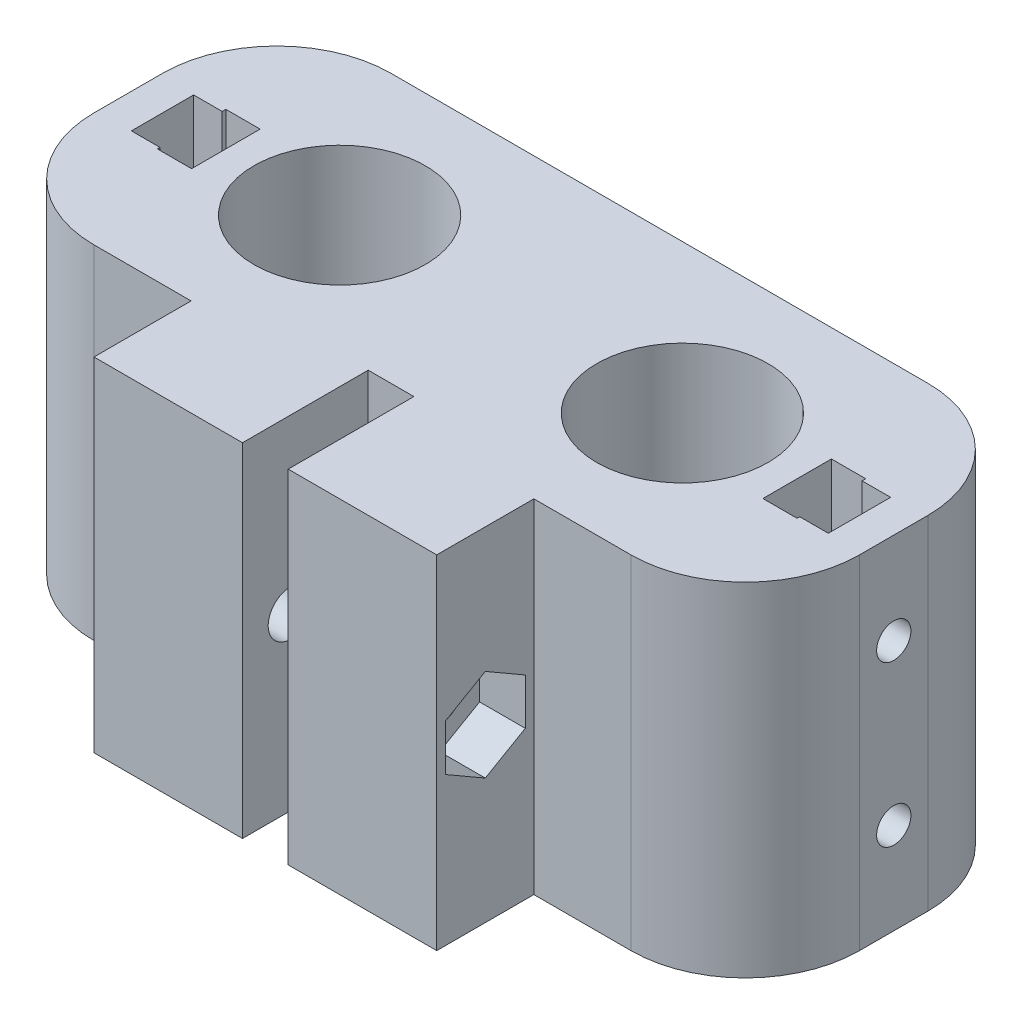
from build123d import *

# Parameters (mm, degrees)
BOSS_EXTRUDE1_OUTLINE_R = 7.5
BOSS_EXTRUDE1_DEPTH     = 30
SKETCH1_3_R             = 7.5
SKETCH1_3_R_2           = 5
BOSS_EXTRUDE2_DEPTH     = 5
FILLET1_R               = 10
CUT_EXTRUDE6_DEPTH      = 4
SKETCH5_3_R             = 2
CUT_EXTRUDE7_DEPTH      = 35
SKETCH10_R              = 1.5
CUT_EXTRUDE11_DEPTH     = 4
CUT_EXTRUDE12_START     = -2.5
SKETCH10_5_R            = 1.5
CUT_EXTRUDE12_DEPTH     = 2.5
CUT_EXTRUDE13_DEPTH     = 34


# Read off the part's stored shape, not the designer's step: Boss-Extrude1
with BuildPart() as part:
    # Boss-Extrude1 outline → Boss-Extrude1 (new body)
    with BuildSketch(Plane(origin=(0, 0, 0), x_dir=(1, 0, 0), z_dir=(0, 1, 0))):
        Polygon((-33.5, 13), (-33.5, -13), (-15, -13), (-15, -21.5), (-2, -21.5), (-2, -10.5), (2, -10.5), (2, -21.5), (15, -21.5), (15, -13), (33.5, -13), (33.5, 13), align=None)
        with Locations((-15, 0)):
            Circle(BOSS_EXTRUDE1_OUTLINE_R, mode=Mode.SUBTRACT)
        with Locations((15, 0)):
            Circle(BOSS_EXTRUDE1_OUTLINE_R, mode=Mode.SUBTRACT)
    extrude(amount=BOSS_EXTRUDE1_DEPTH)

    # Sketch1<3> → Boss-Extrude2 (add)
    # profile 1 of 2: a face of its own
    with BuildSketch(Plane(origin=(0, 0, 0), x_dir=(1, 0, 0), z_dir=(0, 1, 0))):
        with Locations(Location((-15, 0, 0), (0, 0, 270))):
            Circle(SKETCH1_3_R)
        with Locations(Location((-15, 0, 0), (0, 0, 270))):
            Circle(SKETCH1_3_R_2, mode=Mode.SUBTRACT)
    # profile 2 of 2: a face of its own
    with BuildSketch(Plane(origin=(0, 0, 0), x_dir=(1, 0, 0), z_dir=(0, 1, 0))):
        with Locations(Location((15, 0, 0), (0, 0, 270))):
            Circle(SKETCH1_3_R)
        with Locations(Location((15, 0, 0), (0, 0, 270))):
            Circle(SKETCH1_3_R_2, mode=Mode.SUBTRACT)
    extrude(amount=BOSS_EXTRUDE2_DEPTH)

    # Fillet1
    fillet1_edges = [part.edges().sort_by_distance(p)[0] for p in [
        (-33.5, 15, -13),
        (33.5, 15, -13),
        (33.5, 15, 13),
        (-33.5, 15, 13),
    ]]
    fillet(fillet1_edges, radius=FILLET1_R)

    # Sketch5 → Cut-Extrude6 (cut)
    with BuildSketch(Plane(origin=(15, 0, 0), x_dir=(0, 0, -1), z_dir=(1, 0, 0))):
        with BuildLine():
            Line((-20.75, 17.020725942), (-20.75, 15))
            Line((-20.75, 15), (-19.25, 15))
            ThreePointArc((-19.25, 15), (-17.25, 17), (-15.25, 15))
            Line((-15.25, 15), (-13.75, 15))
            Line((-13.75, 15), (-13.75, 17.020725942))
            Line((-13.75, 17.020725942), (-17.25, 19.041451884))
            Line((-17.25, 19.041451884), (-20.75, 17.020725942))
        make_face()
        with BuildLine():
            Line((-19.25, 15), (-20.75, 15))
            Line((-20.75, 15), (-20.75, 12.979274058))
            Line((-20.75, 12.979274058), (-17.25, 10.958548116))
            Line((-17.25, 10.958548116), (-13.75, 12.979274058))
            Line((-13.75, 12.979274058), (-13.75, 15))
            Line((-13.75, 15), (-15.25, 15))
            ThreePointArc((-15.25, 15), (-17.25, 13), (-19.25, 15))
        make_face()
    extrude(amount=-CUT_EXTRUDE6_DEPTH, mode=Mode.SUBTRACT)

    # Sketch5<3> → Cut-Extrude7 (cut)
    with BuildSketch(Plane(origin=(15, 0, 0), x_dir=(0, 0, -1), z_dir=(1, 0, 0))):
        with Locations((-17.25, 15)):
            Circle(SKETCH5_3_R)
    extrude(amount=-CUT_EXTRUDE7_DEPTH, mode=Mode.SUBTRACT)

    # Sketch10 → Cut-Extrude11 (cut)
    with BuildSketch(Plane(origin=(30.5, 0, 0), x_dir=(0, 0, -1), z_dir=(1, 0, 0))):
        with Locations((0, 22)):
            Circle(SKETCH10_R)
        with Locations((0, 8)):
            Circle(SKETCH10_R)
    cut_extrude11 = extrude(amount=CUT_EXTRUDE11_DEPTH, mode=Mode.SUBTRACT)

    # Sketch10<5> → Cut-Extrude12 (cut)
    # profile 1 of 5: a face of its own
    with BuildSketch(Plane(origin=(30.5, 0, 0), x_dir=(0, 0, -1), z_dir=(1, 0, 0)).offset(CUT_EXTRUDE12_START)):
        Polygon((-2.725, 30), (2.725, 30), (2.725, 23.573279484), (0, 25.146558967), (-2.725, 23.573279484), align=None)
    # profile 2 of 5: a face of its own
    with BuildSketch(Plane(origin=(30.5, 0, 0), x_dir=(0, 0, -1), z_dir=(1, 0, 0)).offset(CUT_EXTRUDE12_START)):
        Polygon((2.725, 20.426720516), (2.725, 23.573279484), (0, 25.146558967), (-2.725, 23.573279484), (-2.725, 20.426720516), (0, 18.853441033), align=None)
        with Locations((0, 22)):
            Circle(SKETCH10_5_R, mode=Mode.SUBTRACT)
    # profile 3 of 5: a face of its own
    with BuildSketch(Plane(origin=(30.5, 0, 0), x_dir=(0, 0, -1), z_dir=(1, 0, 0)).offset(CUT_EXTRUDE12_START)):
        with Locations((0, 22)):
            Circle(SKETCH10_5_R)
    # profile 4 of 5: a face of its own
    with BuildSketch(Plane(origin=(30.5, 0, 0), x_dir=(0, 0, -1), z_dir=(1, 0, 0)).offset(CUT_EXTRUDE12_START)):
        Polygon((-2.725, 6.426720516), (-2.725, 9.573279484), (0, 11.146558967), (2.725, 9.573279484), (2.725, 6.426720516), (2.725, 0), (-2.725, 0), align=None)
        with Locations((0, 8)):
            Circle(SKETCH10_5_R, mode=Mode.SUBTRACT)
    # profile 5 of 5: a face of its own
    with BuildSketch(Plane(origin=(30.5, 0, 0), x_dir=(0, 0, -1), z_dir=(1, 0, 0)).offset(CUT_EXTRUDE12_START)):
        with Locations((0, 8)):
            Circle(SKETCH10_5_R)
    cut_extrude12 = extrude(amount=CUT_EXTRUDE12_DEPTH, mode=Mode.SUBTRACT)

    # Sketch11 → Cut-Extrude13 (cut)
    with BuildSketch(Plane(origin=(0, 30, 0), x_dir=(1, 0, 0), z_dir=(0, 1, 0))):
        Polygon((28, 2.725), (28, 3.043492212), (25, 3.043492212), (25, -2.956507788), (28, -2.956507788), (28, -2.638015576), align=None)
    cut_extrude13 = extrude(amount=-CUT_EXTRUDE13_DEPTH, mode=Mode.SUBTRACT)

    # Mirror1: Cut-Extrude11, Cut-Extrude12, Cut-Extrude13 across plane
    add(cut_extrude11.mirror(Plane(origin=(0, 0, 0), x_dir=(0, 0, 1), z_dir=(1, 0, 0))), mode=Mode.SUBTRACT)
    add(cut_extrude12.mirror(Plane(origin=(0, 0, 0), x_dir=(0, 0, 1), z_dir=(1, 0, 0))), mode=Mode.SUBTRACT)
    add(cut_extrude13.mirror(Plane(origin=(0, 0, 0), x_dir=(0, 0, 1), z_dir=(1, 0, 0))), mode=Mode.SUBTRACT)


solid = part.part
